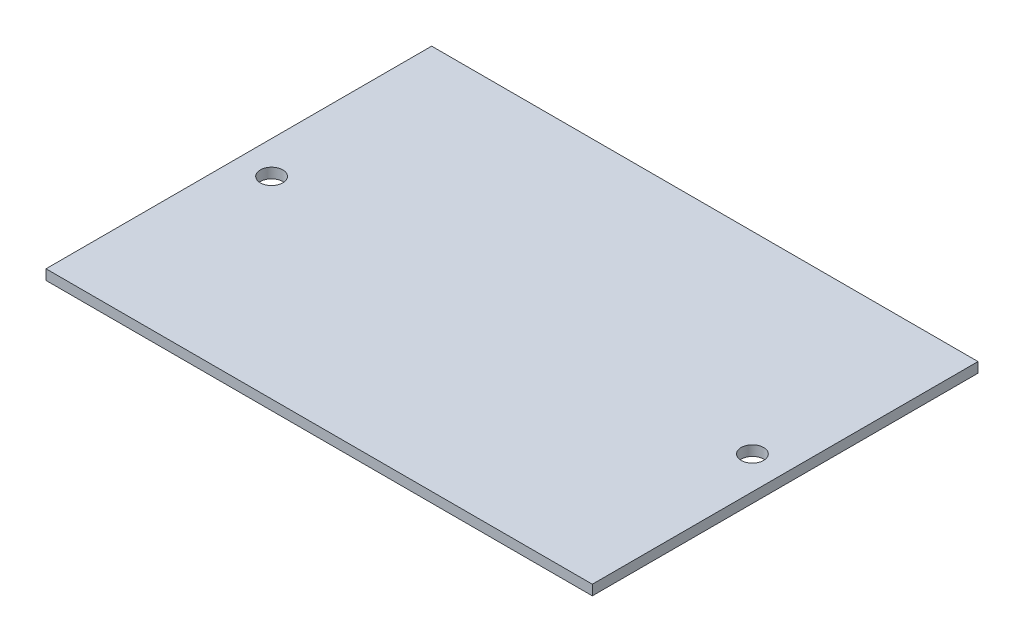
from build123d import *

# Parameters (mm, degrees)
SKETCH1_W           = 86.36
SKETCH1_H           = 60.96
BOSS_EXTRUDE1_DEPTH = 1.6
CUT_EXTRUDE1_REACH  = 54.878
SKETCH2_R           = 1.778


with BuildPart() as part:
    # Sketch1 → Boss-Extrude1 (new body)
    with BuildSketch(Plane(origin=(0, 0, 0), x_dir=(1, 0, 0), z_dir=(0, 1, 0))):
        Rectangle(SKETCH1_W, SKETCH1_H)
    extrude(amount=BOSS_EXTRUDE1_DEPTH)

    # Sketch2 → Cut-Extrude1 (cut, up to next)
    with BuildSketch(Plane(origin=(0, 1.6, 0), x_dir=(1, 0, 0), z_dir=(0, 1, 0)), mode=Mode.PRIVATE) as cut_extrude1_sk1:
        with Locations((-38, 0)):
            Circle(SKETCH2_R)
    cut_extrude1_tool1 = extrude(cut_extrude1_sk1.sketch, amount=-CUT_EXTRUDE1_REACH, mode=Mode.PRIVATE) & part.part
    # Sketch2 → Cut-Extrude1 (cut, up to next)
    with BuildSketch(Plane(origin=(0, 1.6, 0), x_dir=(1, 0, 0), z_dir=(0, 1, 0)), mode=Mode.PRIVATE) as cut_extrude1_sk2:
        with Locations((38, 0)):
            Circle(SKETCH2_R)
    cut_extrude1_tool2 = extrude(cut_extrude1_sk2.sketch, amount=-CUT_EXTRUDE1_REACH, mode=Mode.PRIVATE) & part.part
    add(cut_extrude1_tool1.solids().sort_by_distance((-38, 1.6, 0))[0], mode=Mode.SUBTRACT)
    add(cut_extrude1_tool2.solids().sort_by_distance((38, 1.6, 0))[0], mode=Mode.SUBTRACT)


solid = part.part
